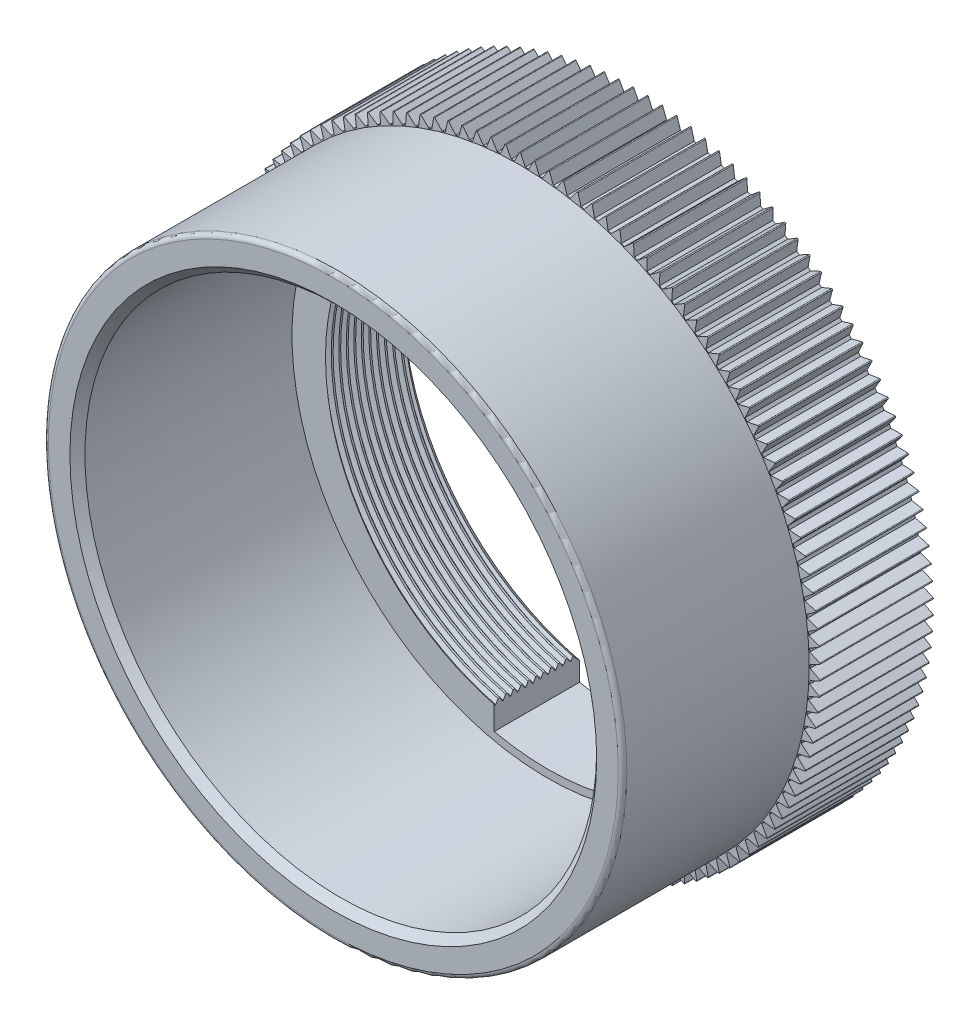
from build123d import *

# Parameters (mm, degrees)
RESSALTO_EXTRUS_O1_DEPTH = 5.28
ESBO_O2_R                = 13.48
RESSALTO_EXTRUS_O2_DEPTH = 8.7
ESBO_O3_R                = 11.925
CORTE_EXTRUS_O1_DEPTH    = 10
ESBO_O4_R                = 10.35
CORTE_EXTRUS_O2_DEPTH    = 26
CHANFRO1_SIZE            = 0.35
ROSCA1_PITCH             = 0.35
CHANFRO2_SIZE            = 0.35
FILETE1_R                = 0.2
CORTE_EXTRUS_O3_DEPTH    = 26


with BuildPart() as part:
    # Esboço1 → Ressalto-extrusão1 (new body)
    with BuildSketch(Plane.XY):
        with BuildLine():
            Line((0.403488834, 13.516290052), (0.648354234, 13.962173214))
            ThreePointArc((0.648354234, 13.962173214), (0.67609933, 13.977697389), (0.702216602, 13.959567899))
            Line((0.702216602, 13.959567899), (0.902904948, 13.492133362))
            Line((0.902904948, 13.492133362), (1.056035302, 13.481012182))
            Line((1.056035302, 13.481012182), (1.322156877, 13.914544379))
            ThreePointArc((1.322156877, 13.914544379), (1.350619598, 13.928709966), (1.375830474, 13.909339832))
            Line((1.375830474, 13.909339832), (1.553701119, 13.432755221))
            Line((1.553701119, 13.432755221), (1.70611535, 13.414248783))
            Line((1.70611535, 13.414248783), (1.992871561, 13.83441748))
            ThreePointArc((1.992871561, 13.83441748), (2.021985431, 13.847191395), (2.046231031, 13.826625859))
            Line((2.046231031, 13.826625859), (2.20086855, 13.342004258))
            Line((2.20086855, 13.342004258), (2.352210687, 13.316155785))
            Line((2.352210687, 13.316155785), (2.658931801, 13.721979658))
            ThreePointArc((2.658931801, 13.721979658), (2.688628824, 13.733332067), (2.71185252, 13.71161916))
            Line((2.71185252, 13.71161916), (2.84289575, 13.220092426))
            Line((2.84289575, 13.220092426), (2.992812327, 13.186962288))
            Line((2.992812327, 13.186962288), (3.318781983, 13.577493518))
            ThreePointArc((3.318781983, 13.577493518), (3.3489928, 13.587397905), (3.371140351, 13.564588339))
            Line((3.371140351, 13.564588339), (3.478283236, 13.067304456))
            Line((3.478283236, 13.067304456), (3.626424115, 13.026970029))
            Line((3.626424115, 13.026970029), (3.970880996, 13.401296511))
            ThreePointArc((3.970880996, 13.401296511), (4.001535048, 13.409729747), (4.022554729, 13.385876793))
            Line((4.022554729, 13.385876793), (4.105547029, 12.88399719))
            Line((4.105547029, 12.88399719), (4.251566221, 12.836552679))
            Line((4.251566221, 12.836552679), (4.613705832, 13.193800156))
            ThreePointArc((4.613705832, 13.193800156), (4.644731525, 13.200742543), (4.664574243, 13.175901912))
            Line((4.664574243, 13.175901912), (4.723222128, 12.670598752))
            Line((4.723222128, 12.670598752), (4.866778597, 12.616154964))
            Line((4.866778597, 12.616154964), (5.245755144, 12.95548907))
            ThreePointArc((5.245755144, 12.95548907), (5.277080017, 12.960924393), (5.295699428, 12.935154102))
            Line((5.295699428, 12.935154102), (5.329865922, 12.427607543))
            Line((5.329865922, 12.427607543), (5.470624387, 12.366291636))
            Line((5.470624387, 12.366291636), (5.865552753, 12.686919838))
            ThreePointArc((5.865552753, 12.686919838), (5.897103643, 12.690835403), (5.914456262, 12.66419564))
            Line((5.914456262, 12.66419564), (5.924061567, 12.155591082))
            Line((5.924061567, 12.155591082), (6.06169328, 12.08754626))
            Line((6.06169328, 12.08754626), (6.471651091, 12.388719717))
            ThreePointArc((6.471651091, 12.388719717), (6.503354311, 12.39110638), (6.519399609, 12.363659362))
            Line((6.519399609, 12.363659362), (6.504421292, 11.855184674))
            Line((6.504421292, 11.855184674), (6.638604807, 11.78056986))
            Line((6.638604807, 11.78056986), (7.062634588, 12.061585167))
            ThreePointArc((7.062634588, 12.061585167), (7.094416094, 12.062437353), (7.109116596, 12.034247184))
            Line((7.109116596, 12.034247184), (7.06958964, 11.527089933))
            Line((7.06958964, 11.527089933), (7.200011565, 11.446079393))
            Line((7.200011565, 11.446079393), (7.637122974, 11.706280227))
            ThreePointArc((7.637122974, 11.706280227), (7.668908539, 11.705595945), (7.682229912, 11.676728465))
            Line((7.682229912, 11.676728465), (7.618246634, 11.172073139))
            Line((7.618246634, 11.172073139), (7.744602362, 11.084856077))
            Line((7.744602362, 11.084856077), (8.193774506, 11.323634726))
            ThreePointArc((8.193774506, 11.323634726), (8.225489893, 11.321415576), (8.237401024, 11.291938206))
            Line((8.237401024, 11.291938206), (8.14911086, 10.790963451))
            Line((8.14911086, 10.790963451), (8.271105282, 10.697743566))
            Line((8.271105282, 10.697743566), (8.731289099, 10.914542352))
            ThreePointArc((8.731289099, 10.914542352), (8.762860234, 10.910793515), (8.773333304, 10.880775101))
            Line((8.773333304, 10.880775101), (8.660942459, 10.384650968))
            Line((8.660942459, 10.384650968), (8.778290652, 10.28564598))
            Line((8.778290652, 10.28564598), (9.24841136, 10.479958558))
            ThreePointArc((9.24841136, 10.479958558), (9.279764509, 10.474688791), (9.288775058, 10.444199443))
            Line((9.288775058, 10.444199443), (9.152546026, 9.954084651))
            Line((9.152546026, 9.954084651), (9.264973918, 9.849525791))
            Line((9.264973918, 9.849525791), (9.743933529, 10.020898336))
            ThreePointArc((9.743933529, 10.020898336), (9.774995464, 10.014119946), (9.782522447, 9.983230872))
            Line((9.782522447, 9.983230872), (9.622773398, 9.500270108))
            Line((9.622773398, 9.500270108), (9.730018408, 9.390401577))
            Line((9.730018408, 9.390401577), (10.216698289, 9.538433841))
            ThreePointArc((10.216698289, 9.538433841), (10.247396464, 9.53016266), (10.253422302, 9.498946003))
            Line((10.253422302, 9.498946003), (10.070526337, 9.024267244))
            Line((10.070526337, 9.024267244), (10.172337989, 8.909345646))
            Line((10.172337989, 8.909345646), (10.665601477, 9.033691892))
            ThreePointArc((10.665601477, 9.033691892), (10.695864195, 9.023947237), (10.700374814, 8.992475906))
            Line((10.700374814, 8.992475906), (10.494759095, 8.527187786))
            Line((10.494759095, 8.527187786), (10.590899603, 8.407481526))
            Line((10.590899603, 8.407481526), (11.089594659, 8.507851337))
            ThreePointArc((11.089594659, 8.507851337), (11.119351239, 8.496655967), (11.122336104, 8.465003464))
            Line((11.122336104, 8.465003464), (10.894480857, 8.010192686))
            Line((10.894480857, 8.010192686), (10.98472568, 7.885981342))
            Line((10.98472568, 7.885981342), (11.487687579, 7.962140301))
            ThreePointArc((11.487687579, 7.962140301), (11.516868524, 7.949520364), (11.518320664, 7.917760615))
            Line((11.518320664, 7.917760615), (11.268758054, 7.474489409))
            Line((11.268758054, 7.474489409), (11.352896422, 7.346063084))
            Line((11.352896422, 7.346063084), (11.858950471, 7.397833317))
            ThreePointArc((11.858950471, 7.397833317), (11.887487628, 7.383818287), (11.887403652, 7.352025469))
            Line((11.887403652, 7.352025469), (11.616716544, 6.921329117))
            Line((11.616716544, 6.921329117), (11.694551948, 6.788987755))
            Line((11.694551948, 6.788987755), (12.202516236, 6.816248351))
            ThreePointArc((12.202516236, 6.816248351), (12.230342954, 6.800870961), (12.228723057, 6.769119327))
            Line((12.228723057, 6.769119327), (11.937543654, 6.352003739))
            Line((11.937543654, 6.352003739), (12.008894306, 6.216056431))
            Line((12.008894306, 6.216056431), (12.517582458, 6.218743721))
            ThreePointArc((12.517582458, 6.218743721), (12.544633748, 6.202039886), (12.541481714, 6.170403593))
            Line((12.541481714, 6.170403593), (12.230490079, 5.767842962))
            Line((12.230490079, 5.767842962), (12.295189335, 5.628607219))
            Line((12.295189335, 5.628607219), (12.803413287, 5.606714927))
            ThreePointArc((12.803413287, 5.606714927), (12.829625968, 5.588723659), (12.824949158, 5.557276595))
            Line((12.824949158, 5.557276595), (12.494871627, 5.170211121))
            Line((12.494871627, 5.170211121), (12.552768379, 5.028012133))
            Line((12.552768379, 5.028012133), (13.059341151, 4.98159139))
            ThreePointArc((13.059341151, 4.98159139), (13.084654002, 4.962354709), (13.07846334, 4.93117032))
            Line((13.07846334, 4.93117032), (12.730070823, 4.560504012))
            Line((12.730070823, 4.560504012), (12.781029852, 4.415673893))
            Line((12.781029852, 4.415673893), (13.284768318, 4.344833116))
            ThreePointArc((13.284768318, 4.344833116), (13.309122221, 4.324395949), (13.301432165, 4.293547069))
            Line((13.301432165, 4.293547069), (12.935538349, 3.940145635))
            Line((12.935538349, 3.940145635), (12.979440637, 3.793022642))
            Line((12.979440637, 3.793022642), (13.479168293, 3.697927283))
            ThreePointArc((13.479168293, 3.697927283), (13.502506368, 3.676337363), (13.493334878, 3.64589604))
            Line((13.493334878, 3.64589604), (13.110794326, 3.310584865))
            Line((13.110794326, 3.310584865), (13.147537337, 3.16151261))
            Line((13.147537337, 3.16151261), (13.642087047, 3.042384769))
            ThreePointArc((13.642087047, 3.042384769), (13.664354785, 3.01969252), (13.653723283, 2.989729851))
            Line((13.653723283, 2.989729851), (13.255429435, 2.673292071))
            Line((13.255429435, 2.673292071), (13.284927354, 2.522618719))
            Line((13.284927354, 2.522618719), (13.773144073, 2.379736625))
            ThreePointArc((13.773144073, 2.379736625), (13.794289469, 2.355995045), (13.782222784, 2.32658101))
            Line((13.782222784, 2.32658101), (13.369105875, 2.029755679))
            Line((13.369105875, 2.029755679), (13.391289808, 1.877833136))
            Line((13.391289808, 1.877833136), (13.872033284, 1.711530495))
            ThreePointArc((13.872033284, 1.711530495), (13.892006951, 1.686795035), (13.878533266, 1.657998331))
            Line((13.878533266, 1.657998331), (13.451558148, 1.381478699))
            Line((13.451558148, 1.381478699), (13.466376284, 1.228661786))
            Line((13.466376284, 1.228661786), (13.938523718, 1.039327007))
            ThreePointArc((13.938523718, 1.039327007), (13.957279007, 1.013655437), (13.942429789, 0.98554332))
            Line((13.942429789, 0.98554332), (13.502593684, 0.729975211))
            Line((13.502593684, 0.729975211), (13.510011414, 0.576620839))
            Line((13.510011414, 0.576620839), (13.972460084, 0.364696122))
            ThreePointArc((13.972460084, 0.364696122), (13.989953191, 0.338148399), (13.973763123, 0.310786527))
            Line((13.973763123, 0.310786527), (13.522093287, 0.076766832))
            Line((13.522093287, 0.076766832), (13.522093287, -0.076766832))
            Line((13.522093287, -0.076766832), (13.973763123, -0.310786527))
            ThreePointArc((13.973763123, -0.310786527), (13.989953191, -0.338148399), (13.972460084, -0.364696122))
            Line((13.972460084, -0.364696122), (13.510011414, -0.576620839))
            Line((13.510011414, -0.576620839), (13.502593684, -0.729975211))
            Line((13.502593684, -0.729975211), (13.942429789, -0.98554332))
            ThreePointArc((13.942429789, -0.98554332), (13.957279007, -1.013655437), (13.938523718, -1.039327007))
            Line((13.938523718, -1.039327007), (13.466376284, -1.228661786))
            Line((13.466376284, -1.228661786), (13.451558148, -1.381478699))
            Line((13.451558148, -1.381478699), (13.878533266, -1.657998331))
            ThreePointArc((13.878533266, -1.657998331), (13.892006951, -1.686795035), (13.872033284, -1.711530495))
            Line((13.872033284, -1.711530495), (13.391289808, -1.877833136))
            Line((13.391289808, -1.877833136), (13.369105875, -2.029755679))
            Line((13.369105875, -2.029755679), (13.782222784, -2.32658101))
            ThreePointArc((13.782222784, -2.32658101), (13.794289469, -2.355995045), (13.773144073, -2.379736625))
            Line((13.773144073, -2.379736625), (13.284927354, -2.522618719))
            Line((13.284927354, -2.522618719), (13.255429435, -2.673292071))
            Line((13.255429435, -2.673292071), (13.653723283, -2.989729851))
            ThreePointArc((13.653723283, -2.989729851), (13.664354785, -3.01969252), (13.642087047, -3.042384769))
            Line((13.642087047, -3.042384769), (13.147537337, -3.16151261))
            Line((13.147537337, -3.16151261), (13.110794326, -3.310584865))
            Line((13.110794326, -3.310584865), (13.493334878, -3.64589604))
            ThreePointArc((13.493334878, -3.64589604), (13.502506368, -3.676337363), (13.479168293, -3.697927283))
            Line((13.479168293, -3.697927283), (12.979440637, -3.793022642))
            Line((12.979440637, -3.793022642), (12.935538349, -3.940145635))
            Line((12.935538349, -3.940145635), (13.301432165, -4.293547069))
            ThreePointArc((13.301432165, -4.293547069), (13.309122221, -4.324395949), (13.284768318, -4.344833116))
            Line((13.284768318, -4.344833116), (12.781029852, -4.415673893))
            Line((12.781029852, -4.415673893), (12.730070823, -4.560504012))
            Line((12.730070823, -4.560504012), (13.07846334, -4.93117032))
            ThreePointArc((13.07846334, -4.93117032), (13.084654002, -4.962354709), (13.059341151, -4.98159139))
            Line((13.059341151, -4.98159139), (12.552768379, -5.028012133))
            Line((12.552768379, -5.028012133), (12.494871627, -5.170211121))
            Line((12.494871627, -5.170211121), (12.824949158, -5.557276595))
            ThreePointArc((12.824949158, -5.557276595), (12.829625968, -5.588723659), (12.803413287, -5.606714927))
            Line((12.803413287, -5.606714927), (12.295189335, -5.628607219))
            Line((12.295189335, -5.628607219), (12.230490079, -5.767842962))
            Line((12.230490079, -5.767842962), (12.541481714, -6.170403593))
            ThreePointArc((12.541481714, -6.170403593), (12.544633748, -6.202039886), (12.517582458, -6.218743721))
            Line((12.517582458, -6.218743721), (12.008894306, -6.216056431))
            Line((12.008894306, -6.216056431), (11.937543654, -6.352003739))
            Line((11.937543654, -6.352003739), (12.228723057, -6.769119327))
            ThreePointArc((12.228723057, -6.769119327), (12.230342954, -6.800870961), (12.202516236, -6.816248351))
            Line((12.202516236, -6.816248351), (11.694551948, -6.788987755))
            Line((11.694551948, -6.788987755), (11.616716544, -6.921329117))
            Line((11.616716544, -6.921329117), (11.887403652, -7.352025469))
            ThreePointArc((11.887403652, -7.352025469), (11.887487628, -7.383818287), (11.858950471, -7.397833317))
            Line((11.858950471, -7.397833317), (11.352896422, -7.346063084))
            Line((11.352896422, -7.346063084), (11.268758054, -7.474489409))
            Line((11.268758054, -7.474489409), (11.518320664, -7.917760615))
            ThreePointArc((11.518320664, -7.917760615), (11.516868524, -7.949520364), (11.487687579, -7.962140301))
            Line((11.487687579, -7.962140301), (10.98472568, -7.885981342))
            Line((10.98472568, -7.885981342), (10.894480857, -8.010192686))
            Line((10.894480857, -8.010192686), (11.122336104, -8.465003464))
            ThreePointArc((11.122336104, -8.465003464), (11.119351239, -8.496655967), (11.089594659, -8.507851337))
            Line((11.089594659, -8.507851337), (10.590899603, -8.407481526))
            Line((10.590899603, -8.407481526), (10.494759095, -8.527187786))
            Line((10.494759095, -8.527187786), (10.700374814, -8.992475906))
            ThreePointArc((10.700374814, -8.992475906), (10.695864195, -9.023947237), (10.665601477, -9.033691892))
            Line((10.665601477, -9.033691892), (10.172337989, -8.909345646))
            Line((10.172337989, -8.909345646), (10.070526337, -9.024267244))
            Line((10.070526337, -9.024267244), (10.253422302, -9.498946003))
            ThreePointArc((10.253422302, -9.498946003), (10.247396464, -9.53016266), (10.216698289, -9.538433841))
            Line((10.216698289, -9.538433841), (9.730018408, -9.390401577))
            Line((9.730018408, -9.390401577), (9.622773398, -9.500270108))
            Line((9.622773398, -9.500270108), (9.782522447, -9.983230872))
            ThreePointArc((9.782522447, -9.983230872), (9.774995464, -10.014119946), (9.743933529, -10.020898336))
            Line((9.743933529, -10.020898336), (9.264973918, -9.849525791))
            Line((9.264973918, -9.849525791), (9.152546026, -9.954084651))
            Line((9.152546026, -9.954084651), (9.288775058, -10.444199443))
            ThreePointArc((9.288775058, -10.444199443), (9.279764509, -10.474688791), (9.24841136, -10.479958558))
            Line((9.24841136, -10.479958558), (8.778290652, -10.28564598))
            Line((8.778290652, -10.28564598), (8.660942459, -10.384650968))
            Line((8.660942459, -10.384650968), (8.773333304, -10.880775101))
            ThreePointArc((8.773333304, -10.880775101), (8.762860234, -10.910793515), (8.731289099, -10.914542352))
            Line((8.731289099, -10.914542352), (8.271105282, -10.697743566))
            Line((8.271105282, -10.697743566), (8.14911086, -10.790963451))
            Line((8.14911086, -10.790963451), (8.237401024, -11.291938206))
            ThreePointArc((8.237401024, -11.291938206), (8.225489893, -11.321415576), (8.193774506, -11.323634726))
            Line((8.193774506, -11.323634726), (7.744602362, -11.084856077))
            Line((7.744602362, -11.084856077), (7.618246634, -11.172073139))
            Line((7.618246634, -11.172073139), (7.682229912, -11.676728465))
            ThreePointArc((7.682229912, -11.676728465), (7.668908539, -11.705595945), (7.637122974, -11.706280227))
            Line((7.637122974, -11.706280227), (7.200011565, -11.446079393))
            Line((7.200011565, -11.446079393), (7.06958964, -11.527089933))
            Line((7.06958964, -11.527089933), (7.109116596, -12.034247184))
            ThreePointArc((7.109116596, -12.034247184), (7.094416094, -12.062437353), (7.062634588, -12.061585167))
            Line((7.062634588, -12.061585167), (6.638604807, -11.78056986))
            Line((6.638604807, -11.78056986), (6.504421292, -11.855184674))
            Line((6.504421292, -11.855184674), (6.519399609, -12.363659362))
            ThreePointArc((6.519399609, -12.363659362), (6.503354311, -12.39110638), (6.471651091, -12.388719717))
            Line((6.471651091, -12.388719717), (6.06169328, -12.08754626))
            Line((6.06169328, -12.08754626), (5.924061567, -12.155591082))
            Line((5.924061567, -12.155591082), (5.914456262, -12.66419564))
            ThreePointArc((5.914456262, -12.66419564), (5.897103643, -12.690835403), (5.865552753, -12.686919838))
            Line((5.865552753, -12.686919838), (5.470624387, -12.366291636))
            Line((5.470624387, -12.366291636), (5.329865922, -12.427607543))
            Line((5.329865922, -12.427607543), (5.295699428, -12.935154102))
            ThreePointArc((5.295699428, -12.935154102), (5.277080017, -12.960924393), (5.245755144, -12.95548907))
            Line((5.245755144, -12.95548907), (4.866778597, -12.616154964))
            Line((4.866778597, -12.616154964), (4.723222128, -12.670598752))
            Line((4.723222128, -12.670598752), (4.664574243, -13.175901912))
            ThreePointArc((4.664574243, -13.175901912), (4.644731525, -13.200742543), (4.613705832, -13.193800156))
            Line((4.613705832, -13.193800156), (4.251566221, -12.836552679))
            Line((4.251566221, -12.836552679), (4.105547029, -12.88399719))
            Line((4.105547029, -12.88399719), (4.022554729, -13.385876793))
            ThreePointArc((4.022554729, -13.385876793), (4.001535048, -13.409729747), (3.970880996, -13.401296511))
            Line((3.970880996, -13.401296511), (3.626424115, -13.026970029))
            Line((3.626424115, -13.026970029), (3.478283236, -13.067304456))
            Line((3.478283236, -13.067304456), (3.371140351, -13.564588339))
            ThreePointArc((3.371140351, -13.564588339), (3.3489928, -13.587397905), (3.318781983, -13.577493518))
            Line((3.318781983, -13.577493518), (2.992812327, -13.186962288))
            Line((2.992812327, -13.186962288), (2.84289575, -13.220092426))
            Line((2.84289575, -13.220092426), (2.71185252, -13.71161916))
            ThreePointArc((2.71185252, -13.71161916), (2.688628824, -13.733332067), (2.658931801, -13.721979658))
            Line((2.658931801, -13.721979658), (2.352210687, -13.316155785))
            Line((2.352210687, -13.316155785), (2.20086855, -13.342004258))
            Line((2.20086855, -13.342004258), (2.046231031, -13.826625859))
            ThreePointArc((2.046231031, -13.826625859), (2.021985431, -13.847191395), (1.992871561, -13.83441748))
            Line((1.992871561, -13.83441748), (1.70611535, -13.414248783))
            Line((1.70611535, -13.414248783), (1.553701119, -13.432755221))
            Line((1.553701119, -13.432755221), (1.375830474, -13.909339832))
            ThreePointArc((1.375830474, -13.909339832), (1.350619598, -13.928709966), (1.322156877, -13.914544379))
            Line((1.322156877, -13.914544379), (1.056035302, -13.481012182))
            Line((1.056035302, -13.481012182), (0.902904948, -13.492133362))
            Line((0.902904948, -13.492133362), (0.702216602, -13.959567899))
            ThreePointArc((0.702216602, -13.959567899), (0.67609933, -13.977697389), (0.648354234, -13.962173214))
            Line((0.648354234, -13.962173214), (0.403488834, -13.516290052))
            Line((0.403488834, -13.516290052), (0.25, -13.52))
            Line((0.25, -13.52), (0.02696267, -13.977192747))
            ThreePointArc((0.02696267, -13.977192747), (0, -13.994039253), (-0.02696267, -13.977192747))
            Line((-0.02696267, -13.977192747), (-0.25, -13.52))
            Line((-0.25, -13.52), (-0.403488834, -13.516290052))
            Line((-0.403488834, -13.516290052), (-0.648354234, -13.962173214))
            ThreePointArc((-0.648354234, -13.962173214), (-0.67609933, -13.977697389), (-0.702216602, -13.959567899))
            Line((-0.702216602, -13.959567899), (-0.902904948, -13.492133362))
            Line((-0.902904948, -13.492133362), (-1.056035302, -13.481012182))
            Line((-1.056035302, -13.481012182), (-1.322156877, -13.914544379))
            ThreePointArc((-1.322156877, -13.914544379), (-1.350619598, -13.928709966), (-1.375830474, -13.909339832))
            Line((-1.375830474, -13.909339832), (-1.553701119, -13.432755221))
            Line((-1.553701119, -13.432755221), (-1.70611535, -13.414248783))
            Line((-1.70611535, -13.414248783), (-1.992871561, -13.83441748))
            ThreePointArc((-1.992871561, -13.83441748), (-2.021985431, -13.847191395), (-2.046231031, -13.826625859))
            Line((-2.046231031, -13.826625859), (-2.20086855, -13.342004258))
            Line((-2.20086855, -13.342004258), (-2.352210687, -13.316155785))
            Line((-2.352210687, -13.316155785), (-2.658931801, -13.721979658))
            ThreePointArc((-2.658931801, -13.721979658), (-2.688628824, -13.733332067), (-2.71185252, -13.71161916))
            Line((-2.71185252, -13.71161916), (-2.84289575, -13.220092426))
            Line((-2.84289575, -13.220092426), (-2.992812327, -13.186962288))
            Line((-2.992812327, -13.186962288), (-3.318781983, -13.577493518))
            ThreePointArc((-3.318781983, -13.577493518), (-3.3489928, -13.587397905), (-3.371140351, -13.564588339))
            Line((-3.371140351, -13.564588339), (-3.478283236, -13.067304456))
            Line((-3.478283236, -13.067304456), (-3.626424115, -13.026970029))
            Line((-3.626424115, -13.026970029), (-3.970880996, -13.401296511))
            ThreePointArc((-3.970880996, -13.401296511), (-4.001535048, -13.409729747), (-4.022554729, -13.385876793))
            Line((-4.022554729, -13.385876793), (-4.105547029, -12.88399719))
            Line((-4.105547029, -12.88399719), (-4.251566221, -12.836552679))
            Line((-4.251566221, -12.836552679), (-4.613705832, -13.193800156))
            ThreePointArc((-4.613705832, -13.193800156), (-4.644731525, -13.200742543), (-4.664574243, -13.175901912))
            Line((-4.664574243, -13.175901912), (-4.723222128, -12.670598752))
            Line((-4.723222128, -12.670598752), (-4.866778597, -12.616154964))
            Line((-4.866778597, -12.616154964), (-5.245755144, -12.95548907))
            ThreePointArc((-5.245755144, -12.95548907), (-5.277080017, -12.960924393), (-5.295699428, -12.935154102))
            Line((-5.295699428, -12.935154102), (-5.329865922, -12.427607543))
            Line((-5.329865922, -12.427607543), (-5.470624387, -12.366291636))
            Line((-5.470624387, -12.366291636), (-5.865552753, -12.686919838))
            ThreePointArc((-5.865552753, -12.686919838), (-5.897103643, -12.690835403), (-5.914456262, -12.66419564))
            Line((-5.914456262, -12.66419564), (-5.924061567, -12.155591082))
            Line((-5.924061567, -12.155591082), (-6.06169328, -12.08754626))
            Line((-6.06169328, -12.08754626), (-6.471651091, -12.388719717))
            ThreePointArc((-6.471651091, -12.388719717), (-6.503354311, -12.39110638), (-6.519399609, -12.363659362))
            Line((-6.519399609, -12.363659362), (-6.504421292, -11.855184674))
            Line((-6.504421292, -11.855184674), (-6.638604807, -11.78056986))
            Line((-6.638604807, -11.78056986), (-7.062634588, -12.061585167))
            ThreePointArc((-7.062634588, -12.061585167), (-7.094416094, -12.062437353), (-7.109116596, -12.034247184))
            Line((-7.109116596, -12.034247184), (-7.06958964, -11.527089933))
            Line((-7.06958964, -11.527089933), (-7.200011565, -11.446079393))
            Line((-7.200011565, -11.446079393), (-7.637122974, -11.706280227))
            ThreePointArc((-7.637122974, -11.706280227), (-7.668908539, -11.705595945), (-7.682229912, -11.676728465))
            Line((-7.682229912, -11.676728465), (-7.618246634, -11.172073139))
            Line((-7.618246634, -11.172073139), (-7.744602362, -11.084856077))
            Line((-7.744602362, -11.084856077), (-8.193774506, -11.323634726))
            ThreePointArc((-8.193774506, -11.323634726), (-8.225489893, -11.321415576), (-8.237401024, -11.291938206))
            Line((-8.237401024, -11.291938206), (-8.14911086, -10.790963451))
            Line((-8.14911086, -10.790963451), (-8.271105282, -10.697743566))
            Line((-8.271105282, -10.697743566), (-8.731289099, -10.914542352))
            ThreePointArc((-8.731289099, -10.914542352), (-8.762860234, -10.910793515), (-8.773333304, -10.880775101))
            Line((-8.773333304, -10.880775101), (-8.660942459, -10.384650968))
            Line((-8.660942459, -10.384650968), (-8.778290652, -10.28564598))
            Line((-8.778290652, -10.28564598), (-9.24841136, -10.479958558))
            ThreePointArc((-9.24841136, -10.479958558), (-9.279764509, -10.474688791), (-9.288775058, -10.444199443))
            Line((-9.288775058, -10.444199443), (-9.152546026, -9.954084651))
            Line((-9.152546026, -9.954084651), (-9.264973918, -9.849525791))
            Line((-9.264973918, -9.849525791), (-9.743933529, -10.020898336))
            ThreePointArc((-9.743933529, -10.020898336), (-9.774995464, -10.014119946), (-9.782522447, -9.983230872))
            Line((-9.782522447, -9.983230872), (-9.622773398, -9.500270108))
            Line((-9.622773398, -9.500270108), (-9.730018408, -9.390401577))
            Line((-9.730018408, -9.390401577), (-10.216698289, -9.538433841))
            ThreePointArc((-10.216698289, -9.538433841), (-10.247396464, -9.53016266), (-10.253422302, -9.498946003))
            Line((-10.253422302, -9.498946003), (-10.070526337, -9.024267244))
            Line((-10.070526337, -9.024267244), (-10.172337989, -8.909345646))
            Line((-10.172337989, -8.909345646), (-10.665601477, -9.033691892))
            ThreePointArc((-10.665601477, -9.033691892), (-10.695864195, -9.023947237), (-10.700374814, -8.992475906))
            Line((-10.700374814, -8.992475906), (-10.494759095, -8.527187786))
            Line((-10.494759095, -8.527187786), (-10.590899603, -8.407481526))
            Line((-10.590899603, -8.407481526), (-11.089594659, -8.507851337))
            ThreePointArc((-11.089594659, -8.507851337), (-11.119351239, -8.496655967), (-11.122336104, -8.465003464))
            Line((-11.122336104, -8.465003464), (-10.894480857, -8.010192686))
            Line((-10.894480857, -8.010192686), (-10.98472568, -7.885981342))
            Line((-10.98472568, -7.885981342), (-11.487687579, -7.962140301))
            ThreePointArc((-11.487687579, -7.962140301), (-11.516868524, -7.949520364), (-11.518320664, -7.917760615))
            Line((-11.518320664, -7.917760615), (-11.268758054, -7.474489409))
            Line((-11.268758054, -7.474489409), (-11.352896422, -7.346063084))
            Line((-11.352896422, -7.346063084), (-11.858950471, -7.397833317))
            ThreePointArc((-11.858950471, -7.397833317), (-11.887487628, -7.383818287), (-11.887403652, -7.352025469))
            Line((-11.887403652, -7.352025469), (-11.616716544, -6.921329117))
            Line((-11.616716544, -6.921329117), (-11.694551948, -6.788987755))
            Line((-11.694551948, -6.788987755), (-12.202516236, -6.816248351))
            ThreePointArc((-12.202516236, -6.816248351), (-12.230342954, -6.800870961), (-12.228723057, -6.769119327))
            Line((-12.228723057, -6.769119327), (-11.937543654, -6.352003739))
            Line((-11.937543654, -6.352003739), (-12.008894306, -6.216056431))
            Line((-12.008894306, -6.216056431), (-12.517582458, -6.218743721))
            ThreePointArc((-12.517582458, -6.218743721), (-12.544633748, -6.202039886), (-12.541481714, -6.170403593))
            Line((-12.541481714, -6.170403593), (-12.230490079, -5.767842962))
            Line((-12.230490079, -5.767842962), (-12.295189335, -5.628607219))
            Line((-12.295189335, -5.628607219), (-12.803413287, -5.606714927))
            ThreePointArc((-12.803413287, -5.606714927), (-12.829625968, -5.588723659), (-12.824949158, -5.557276595))
            Line((-12.824949158, -5.557276595), (-12.494871627, -5.170211121))
            Line((-12.494871627, -5.170211121), (-12.552768379, -5.028012133))
            Line((-12.552768379, -5.028012133), (-13.059341151, -4.98159139))
            ThreePointArc((-13.059341151, -4.98159139), (-13.084654002, -4.962354709), (-13.07846334, -4.93117032))
            Line((-13.07846334, -4.93117032), (-12.730070823, -4.560504012))
            Line((-12.730070823, -4.560504012), (-12.781029852, -4.415673893))
            Line((-12.781029852, -4.415673893), (-13.284768318, -4.344833116))
            ThreePointArc((-13.284768318, -4.344833116), (-13.309122221, -4.324395949), (-13.301432165, -4.293547069))
            Line((-13.301432165, -4.293547069), (-12.935538349, -3.940145635))
            Line((-12.935538349, -3.940145635), (-12.979440637, -3.793022642))
            Line((-12.979440637, -3.793022642), (-13.479168293, -3.697927283))
            ThreePointArc((-13.479168293, -3.697927283), (-13.502506368, -3.676337363), (-13.493334878, -3.64589604))
            Line((-13.493334878, -3.64589604), (-13.110794326, -3.310584865))
            Line((-13.110794326, -3.310584865), (-13.147537337, -3.16151261))
            Line((-13.147537337, -3.16151261), (-13.642087047, -3.042384769))
            ThreePointArc((-13.642087047, -3.042384769), (-13.664354785, -3.01969252), (-13.653723283, -2.989729851))
            Line((-13.653723283, -2.989729851), (-13.255429435, -2.673292071))
            Line((-13.255429435, -2.673292071), (-13.284927354, -2.522618719))
            Line((-13.284927354, -2.522618719), (-13.773144073, -2.379736625))
            ThreePointArc((-13.773144073, -2.379736625), (-13.794289469, -2.355995045), (-13.782222784, -2.32658101))
            Line((-13.782222784, -2.32658101), (-13.369105875, -2.029755679))
            Line((-13.369105875, -2.029755679), (-13.391289808, -1.877833136))
            Line((-13.391289808, -1.877833136), (-13.872033284, -1.711530495))
            ThreePointArc((-13.872033284, -1.711530495), (-13.892006951, -1.686795035), (-13.878533266, -1.657998331))
            Line((-13.878533266, -1.657998331), (-13.451558148, -1.381478699))
            Line((-13.451558148, -1.381478699), (-13.466376284, -1.228661786))
            Line((-13.466376284, -1.228661786), (-13.938523718, -1.039327007))
            ThreePointArc((-13.938523718, -1.039327007), (-13.957279007, -1.013655437), (-13.942429789, -0.98554332))
            Line((-13.942429789, -0.98554332), (-13.502593684, -0.729975211))
            Line((-13.502593684, -0.729975211), (-13.510011414, -0.576620839))
            Line((-13.510011414, -0.576620839), (-13.972460084, -0.364696122))
            ThreePointArc((-13.972460084, -0.364696122), (-13.989953191, -0.338148399), (-13.973763123, -0.310786527))
            Line((-13.973763123, -0.310786527), (-13.522093287, -0.076766832))
            Line((-13.522093287, -0.076766832), (-13.522093287, 0.076766832))
            Line((-13.522093287, 0.076766832), (-13.973763123, 0.310786527))
            ThreePointArc((-13.973763123, 0.310786527), (-13.989953191, 0.338148399), (-13.972460084, 0.364696122))
            Line((-13.972460084, 0.364696122), (-13.510011414, 0.576620839))
            Line((-13.510011414, 0.576620839), (-13.502593684, 0.729975211))
            Line((-13.502593684, 0.729975211), (-13.942429789, 0.98554332))
            ThreePointArc((-13.942429789, 0.98554332), (-13.957279007, 1.013655437), (-13.938523718, 1.039327007))
            Line((-13.938523718, 1.039327007), (-13.466376284, 1.228661786))
            Line((-13.466376284, 1.228661786), (-13.451558148, 1.381478699))
            Line((-13.451558148, 1.381478699), (-13.878533266, 1.657998331))
            ThreePointArc((-13.878533266, 1.657998331), (-13.892006951, 1.686795035), (-13.872033284, 1.711530495))
            Line((-13.872033284, 1.711530495), (-13.391289808, 1.877833136))
            Line((-13.391289808, 1.877833136), (-13.369105875, 2.029755679))
            Line((-13.369105875, 2.029755679), (-13.782222784, 2.32658101))
            ThreePointArc((-13.782222784, 2.32658101), (-13.794289469, 2.355995045), (-13.773144073, 2.379736625))
            Line((-13.773144073, 2.379736625), (-13.284927354, 2.522618719))
            Line((-13.284927354, 2.522618719), (-13.255429435, 2.673292071))
            Line((-13.255429435, 2.673292071), (-13.653723283, 2.989729851))
            ThreePointArc((-13.653723283, 2.989729851), (-13.664354785, 3.01969252), (-13.642087047, 3.042384769))
            Line((-13.642087047, 3.042384769), (-13.147537337, 3.16151261))
            Line((-13.147537337, 3.16151261), (-13.110794326, 3.310584865))
            Line((-13.110794326, 3.310584865), (-13.493334878, 3.64589604))
            ThreePointArc((-13.493334878, 3.64589604), (-13.502506368, 3.676337363), (-13.479168293, 3.697927283))
            Line((-13.479168293, 3.697927283), (-12.979440637, 3.793022642))
            Line((-12.979440637, 3.793022642), (-12.935538349, 3.940145635))
            Line((-12.935538349, 3.940145635), (-13.301432165, 4.293547069))
            ThreePointArc((-13.301432165, 4.293547069), (-13.309122221, 4.324395949), (-13.284768318, 4.344833116))
            Line((-13.284768318, 4.344833116), (-12.781029852, 4.415673893))
            Line((-12.781029852, 4.415673893), (-12.730070823, 4.560504012))
            Line((-12.730070823, 4.560504012), (-13.07846334, 4.93117032))
            ThreePointArc((-13.07846334, 4.93117032), (-13.084654002, 4.962354709), (-13.059341151, 4.98159139))
            Line((-13.059341151, 4.98159139), (-12.552768379, 5.028012133))
            Line((-12.552768379, 5.028012133), (-12.494871627, 5.170211121))
            Line((-12.494871627, 5.170211121), (-12.824949158, 5.557276595))
            ThreePointArc((-12.824949158, 5.557276595), (-12.829625968, 5.588723659), (-12.803413287, 5.606714927))
            Line((-12.803413287, 5.606714927), (-12.295189335, 5.628607219))
            Line((-12.295189335, 5.628607219), (-12.230490079, 5.767842962))
            Line((-12.230490079, 5.767842962), (-12.541481714, 6.170403593))
            ThreePointArc((-12.541481714, 6.170403593), (-12.544633748, 6.202039886), (-12.517582458, 6.218743721))
            Line((-12.517582458, 6.218743721), (-12.008894306, 6.216056431))
            Line((-12.008894306, 6.216056431), (-11.937543654, 6.352003739))
            Line((-11.937543654, 6.352003739), (-12.228723057, 6.769119327))
            ThreePointArc((-12.228723057, 6.769119327), (-12.230342954, 6.800870961), (-12.202516236, 6.816248351))
            Line((-12.202516236, 6.816248351), (-11.694551948, 6.788987755))
            Line((-11.694551948, 6.788987755), (-11.616716544, 6.921329117))
            Line((-11.616716544, 6.921329117), (-11.887403652, 7.352025469))
            ThreePointArc((-11.887403652, 7.352025469), (-11.887487628, 7.383818287), (-11.858950471, 7.397833317))
            Line((-11.858950471, 7.397833317), (-11.352896422, 7.346063084))
            Line((-11.352896422, 7.346063084), (-11.268758054, 7.474489409))
            Line((-11.268758054, 7.474489409), (-11.518320664, 7.917760615))
            ThreePointArc((-11.518320664, 7.917760615), (-11.516868524, 7.949520364), (-11.487687579, 7.962140301))
            Line((-11.487687579, 7.962140301), (-10.98472568, 7.885981342))
            Line((-10.98472568, 7.885981342), (-10.894480857, 8.010192686))
            Line((-10.894480857, 8.010192686), (-11.122336104, 8.465003464))
            ThreePointArc((-11.122336104, 8.465003464), (-11.119351239, 8.496655967), (-11.089594659, 8.507851337))
            Line((-11.089594659, 8.507851337), (-10.590899603, 8.407481526))
            Line((-10.590899603, 8.407481526), (-10.494759095, 8.527187786))
            Line((-10.494759095, 8.527187786), (-10.700374814, 8.992475906))
            ThreePointArc((-10.700374814, 8.992475906), (-10.695864195, 9.023947237), (-10.665601477, 9.033691892))
            Line((-10.665601477, 9.033691892), (-10.172337989, 8.909345646))
            Line((-10.172337989, 8.909345646), (-10.070526337, 9.024267244))
            Line((-10.070526337, 9.024267244), (-10.253422302, 9.498946003))
            ThreePointArc((-10.253422302, 9.498946003), (-10.247396464, 9.53016266), (-10.216698289, 9.538433841))
            Line((-10.216698289, 9.538433841), (-9.730018408, 9.390401577))
            Line((-9.730018408, 9.390401577), (-9.622773398, 9.500270108))
            Line((-9.622773398, 9.500270108), (-9.782522447, 9.983230872))
            ThreePointArc((-9.782522447, 9.983230872), (-9.774995464, 10.014119946), (-9.743933529, 10.020898336))
            Line((-9.743933529, 10.020898336), (-9.264973918, 9.849525791))
            Line((-9.264973918, 9.849525791), (-9.152546026, 9.954084651))
            Line((-9.152546026, 9.954084651), (-9.288775058, 10.444199443))
            ThreePointArc((-9.288775058, 10.444199443), (-9.279764509, 10.474688791), (-9.24841136, 10.479958558))
            Line((-9.24841136, 10.479958558), (-8.778290652, 10.28564598))
            Line((-8.778290652, 10.28564598), (-8.660942459, 10.384650968))
            Line((-8.660942459, 10.384650968), (-8.773333304, 10.880775101))
            ThreePointArc((-8.773333304, 10.880775101), (-8.762860234, 10.910793515), (-8.731289099, 10.914542352))
            Line((-8.731289099, 10.914542352), (-8.271105282, 10.697743566))
            Line((-8.271105282, 10.697743566), (-8.14911086, 10.790963451))
            Line((-8.14911086, 10.790963451), (-8.237401024, 11.291938206))
            ThreePointArc((-8.237401024, 11.291938206), (-8.225489893, 11.321415576), (-8.193774506, 11.323634726))
            Line((-8.193774506, 11.323634726), (-7.744602362, 11.084856077))
            Line((-7.744602362, 11.084856077), (-7.618246634, 11.172073139))
            Line((-7.618246634, 11.172073139), (-7.682229912, 11.676728465))
            ThreePointArc((-7.682229912, 11.676728465), (-7.668908539, 11.705595945), (-7.637122974, 11.706280227))
            Line((-7.637122974, 11.706280227), (-7.200011565, 11.446079393))
            Line((-7.200011565, 11.446079393), (-7.06958964, 11.527089933))
            Line((-7.06958964, 11.527089933), (-7.109116596, 12.034247184))
            ThreePointArc((-7.109116596, 12.034247184), (-7.094416094, 12.062437353), (-7.062634588, 12.061585167))
            Line((-7.062634588, 12.061585167), (-6.638604807, 11.78056986))
            Line((-6.638604807, 11.78056986), (-6.504421292, 11.855184674))
            Line((-6.504421292, 11.855184674), (-6.519399609, 12.363659362))
            ThreePointArc((-6.519399609, 12.363659362), (-6.503354311, 12.39110638), (-6.471651091, 12.388719717))
            Line((-6.471651091, 12.388719717), (-6.06169328, 12.08754626))
            Line((-6.06169328, 12.08754626), (-5.924061567, 12.155591082))
            Line((-5.924061567, 12.155591082), (-5.914456262, 12.66419564))
            ThreePointArc((-5.914456262, 12.66419564), (-5.897103643, 12.690835403), (-5.865552753, 12.686919838))
            Line((-5.865552753, 12.686919838), (-5.470624387, 12.366291636))
            Line((-5.470624387, 12.366291636), (-5.329865922, 12.427607543))
            Line((-5.329865922, 12.427607543), (-5.295699428, 12.935154102))
            ThreePointArc((-5.295699428, 12.935154102), (-5.277080017, 12.960924393), (-5.245755144, 12.95548907))
            Line((-5.245755144, 12.95548907), (-4.866778597, 12.616154964))
            Line((-4.866778597, 12.616154964), (-4.723222128, 12.670598752))
            Line((-4.723222128, 12.670598752), (-4.664574243, 13.175901912))
            ThreePointArc((-4.664574243, 13.175901912), (-4.644731525, 13.200742543), (-4.613705832, 13.193800156))
            Line((-4.613705832, 13.193800156), (-4.251566221, 12.836552679))
            Line((-4.251566221, 12.836552679), (-4.105547029, 12.88399719))
            Line((-4.105547029, 12.88399719), (-4.022554729, 13.385876793))
            ThreePointArc((-4.022554729, 13.385876793), (-4.001535048, 13.409729747), (-3.970880996, 13.401296511))
            Line((-3.970880996, 13.401296511), (-3.626424115, 13.026970029))
            Line((-3.626424115, 13.026970029), (-3.478283236, 13.067304456))
            Line((-3.478283236, 13.067304456), (-3.371140351, 13.564588339))
            ThreePointArc((-3.371140351, 13.564588339), (-3.3489928, 13.587397905), (-3.318781983, 13.577493518))
            Line((-3.318781983, 13.577493518), (-2.992812327, 13.186962288))
            Line((-2.992812327, 13.186962288), (-2.84289575, 13.220092426))
            Line((-2.84289575, 13.220092426), (-2.71185252, 13.71161916))
            ThreePointArc((-2.71185252, 13.71161916), (-2.688628824, 13.733332067), (-2.658931801, 13.721979658))
            Line((-2.658931801, 13.721979658), (-2.352210687, 13.316155785))
            Line((-2.352210687, 13.316155785), (-2.20086855, 13.342004258))
            Line((-2.20086855, 13.342004258), (-2.046231031, 13.826625859))
            ThreePointArc((-2.046231031, 13.826625859), (-2.021985431, 13.847191395), (-1.992871561, 13.83441748))
            Line((-1.992871561, 13.83441748), (-1.70611535, 13.414248783))
            Line((-1.70611535, 13.414248783), (-1.553701119, 13.432755221))
            Line((-1.553701119, 13.432755221), (-1.375830474, 13.909339832))
            ThreePointArc((-1.375830474, 13.909339832), (-1.350619598, 13.928709966), (-1.322156877, 13.914544379))
            Line((-1.322156877, 13.914544379), (-1.056035302, 13.481012182))
            Line((-1.056035302, 13.481012182), (-0.902904948, 13.492133362))
            Line((-0.902904948, 13.492133362), (-0.702216602, 13.959567899))
            ThreePointArc((-0.702216602, 13.959567899), (-0.67609933, 13.977697389), (-0.648354234, 13.962173214))
            Line((-0.648354234, 13.962173214), (-0.403488834, 13.516290052))
            Line((-0.403488834, 13.516290052), (-0.25, 13.52))
            Line((-0.25, 13.52), (-0.02696267, 13.977192747))
            ThreePointArc((-0.02696267, 13.977192747), (0, 13.994039253), (0.02696267, 13.977192747))
            Line((0.02696267, 13.977192747), (0.25, 13.52))
            Line((0.25, 13.52), (0.403488834, 13.516290052))
        make_face()
    extrude(amount=RESSALTO_EXTRUS_O1_DEPTH)

    # Esboço2 → Ressalto-extrusão2 (add)
    with BuildSketch(Plane.XY.offset(5.28)):
        Circle(ESBO_O2_R)
    extrude(amount=RESSALTO_EXTRUS_O2_DEPTH)

    # Esboço3 → Corte-extrusão1 (cut)
    with BuildSketch(Plane.XY.offset(13.98)):
        Circle(ESBO_O3_R)
    extrude(amount=-CORTE_EXTRUS_O1_DEPTH, mode=Mode.SUBTRACT)

    # Esboço4 → Corte-extrusão2 (cut)
    with BuildSketch(Plane.XY.offset(3.98)):
        Circle(ESBO_O4_R)
    extrude(amount=-CORTE_EXTRUS_O2_DEPTH, mode=Mode.SUBTRACT)

    # Chanfro1
    chanfro1_edges = [part.edges().sort_by_distance(p)[0] for p in [
        (-10.35, 0, 0),
    ]]
    chamfer(chanfro1_edges, length=CHANFRO1_SIZE)

    # Rosca1: the profile of Perfil da rosca1 profile screwed along a right-hand helix of 20 turns, 6 arcs to a turn; built about Z, then put on its axis
    rosca1_z = Axis((0, 0, 0), (0, 0, 1))
    rosca1_corners = [(10.3497, 0, -0.000173205), (10.539443056, 0, 0.109375), (10.539443056, 0, 0.153125), (10.3497, 0, 0.262673204)]
    with BuildLine(mode=Mode.PRIVATE) as rosca1_profile:
        Line(rosca1_corners[0], rosca1_corners[1])
        Line(rosca1_corners[1], rosca1_corners[2])
        Line(rosca1_corners[2], rosca1_corners[3])
        Line(rosca1_corners[3], rosca1_corners[0])
    rosca1_cap = Face(rosca1_profile.wire())
    rosca1_turn_angles = [0, 30, 60, 90, 120, 150, 180, 210, 240, 270, 300, 330, 360]
    rosca1_turn_weights = [1, 0.8660254037844387, 1, 0.8660254037844387, 1, 0.8660254037844387, 1, 0.8660254037844387, 1, 0.8660254037844387, 1, 0.8660254037844387, 1]
    rosca1_turn_rails = [Edge.make_bspline([Vector(p[0], p[1], 0).rotate(rosca1_z, rosca1_turn_angles[k]) / rosca1_turn_weights[k] + Vector(0, 0, p[2] + ROSCA1_PITCH * rosca1_turn_angles[k] / 360) for k in range(13)], [0, 0, 0, 1, 1, 2, 2, 3, 3, 4, 4, 5, 5, 6, 6, 6], 2, rosca1_turn_weights) for p in rosca1_corners]
    rosca1_turn_sides = [Face.make_surface_from_curves(rosca1_turn_rails[p[0]], rosca1_turn_rails[p[1]]) for p in [(0, 1), (1, 2), (2, 3), (3, 0)]]
    rosca1 = Plane(origin=(0, 0, -0.65), x_dir=(1, 0, 0), z_dir=(0, 0, 1)) * Solid(Shell([*[p.moved(Location((0, 0, ROSCA1_PITCH * i))) for i in range(20) for p in rosca1_turn_sides], rosca1_cap, rosca1_cap.rotate(rosca1_z, 7200).moved(Location((0, 0, ROSCA1_PITCH * 7200 / 360)))]))
    add(rosca1, mode=Mode.SUBTRACT)

    # Chanfro2
    chanfro2_edges = [part.edges().sort_by_distance(p)[0] for p in [
        (-11.925, 0, 13.98),
    ]]
    chamfer(chanfro2_edges, length=CHANFRO2_SIZE)

    # Filete1
    filete1_edges = [part.edges().sort_by_distance(p)[0] for p in [
        (-13.48, 0, 13.98),
    ]]
    fillet(filete1_edges, radius=FILETE1_R)

    # Esboço8 → Corte-extrusão3 (cut)
    with BuildSketch(Plane(origin=(0, 0, 0), x_dir=(-1, 0, 0), z_dir=(0, 0, -1))):
        with BuildLine():
            Line((-2.5, -11.286434335), (-2.5, 11.286434335))
            ThreePointArc((-2.5, 11.286434335), (0, 11.56), (2.5, 11.286434335))
            Line((2.5, 11.286434335), (2.5, -11.286434335))
            ThreePointArc((2.5, -11.286434335), (0, -11.56), (-2.5, -11.286434335))
        make_face()
    extrude(amount=-CORTE_EXTRUS_O3_DEPTH, mode=Mode.SUBTRACT)


solid = part.part
